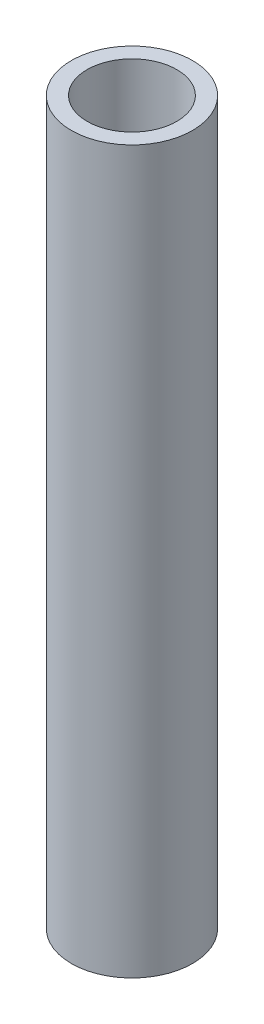
from build123d import *

# Parameters (mm, degrees)
SKETCH1_R           = 10.668
SKETCH1_R_2         = 7.8994
BOSS_EXTRUDE1_DEPTH = 127


with BuildPart() as part:
    # Sketch1 → Boss-Extrude1 (new body)
    with BuildSketch(Plane(origin=(0, 0, 0), x_dir=(1, 0, 0), z_dir=(0, 1, 0))):
        Circle(SKETCH1_R)
        Circle(SKETCH1_R_2, mode=Mode.SUBTRACT)
    extrude(amount=BOSS_EXTRUDE1_DEPTH)


solid = part.part
